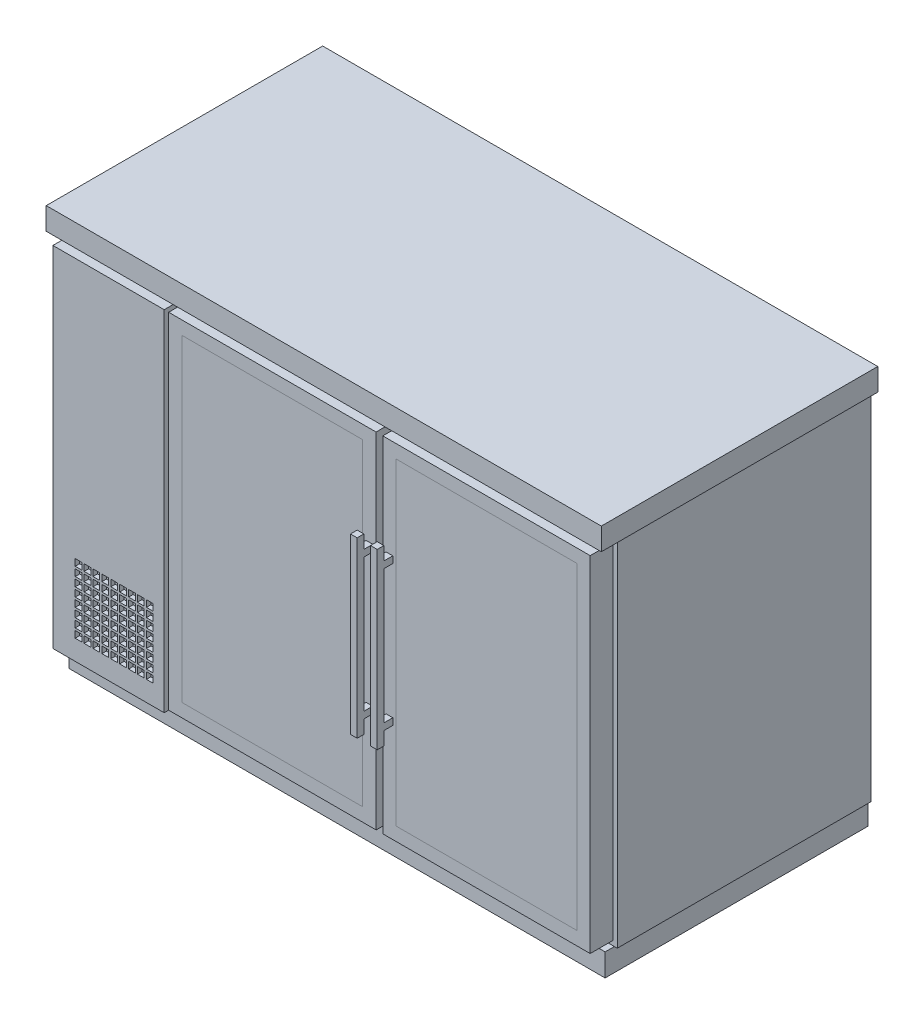
from build123d import *

# Parameters (mm, degrees)
CROQUIS1_W                = 1247
CROQUIS1_H                = 621
SALIENTE_EXTRUIR1_DEPTH   = 50
CROQUIS2_W                = 1217
CROQUIS2_H                = 621
SALIENTE_EXTRUIR2_DEPTH   = 804.2
CROQUIS3_W                = 1204
CROQUIS3_H                = 591
SALIENTE_EXTRUIR3_DEPTH   = 50.8
CROQUIS4_W                = 1217
CROQUIS4_H                = 20
CORTAR_EXTRUIR1_DEPTH     = 50.8
CROQUIS5_W                = 937
CROQUIS5_H                = 754.2
CORTAR_EXTRUIR2_DEPTH     = 570.2
CROQUIS6_W                = 967
CROQUIS6_H                = 784.2
CORTAR_EXTRUIR3_DEPTH     = 50.8
CROQUIS7_W                = 466
CROQUIS7_H                = 774.2
CROQUIS7_W_2              = 406
CROQUIS7_H_2              = 714.2
SALIENTE_EXTRUIR4_DEPTH   = 50.8
SALIENTE_EXTRUIR4_2_DEPTH = 50.8
BARRER1_PROFILE_R         = 6.35
BARRER2_START             = -557.4000001
BARRER2_OUTLINE_R         = 6.35
BARRER2_DEPTH             = 493.8000002
MATRIZL1_COUNT            = 9
MATRIZL1_PITCH            = 51
MATRIZL2_COUNT            = 2
MATRIZL2_PITCH            = 250
CROQUIS35_W               = 15
CROQUIS35_H               = 15
CORTAR_EXTRUIR4_DEPTH     = 10
CROQUIS36_W               = 15
CROQUIS36_H               = 15
SALIENTE_EXTRUIR5_DEPTH   = 35
SALIENTE_EXTRUIR5_2_DEPTH = 35
SALIENTE_EXTRUIR5_3_DEPTH = 35
SALIENTE_EXTRUIR5_4_DEPTH = 35
CROQUIS37_W               = 15
CROQUIS37_H               = 390
SALIENTE_EXTRUIR6_DEPTH   = 15
CROQUIS38_W               = 406
CROQUIS38_H               = 714.2
SALIENTE_EXTRUIR7_DEPTH   = 6
SALIENTE_EXTRUIR7_2_DEPTH = 6


# Read off the part's stored shape, not the designer's step: Barrer2
with BuildPart() as part:
    # Croquis1 → Saliente-Extruir1 (new body)
    with BuildSketch(Plane(origin=(0, 0, 0), x_dir=(1, 0, 0), z_dir=(0, 1, 0))):
        with Locations((623.5, 310.5)):
            Rectangle(CROQUIS1_W, CROQUIS1_H)
    extrude(amount=SALIENTE_EXTRUIR1_DEPTH)


with BuildPart() as body_2:
    # Croquis2 → Saliente-Extruir2 (new body)
    with BuildSketch(Plane.XZ):
        with Locations((623.5, -310.5)):
            Rectangle(CROQUIS2_W, CROQUIS2_H)
    extrude(amount=SALIENTE_EXTRUIR2_DEPTH)

    # Croquis4 → Cortar-Extruir1 (cut)
    with BuildSketch(Plane.XY):
        with Locations((623.5, -10)):
            Rectangle(CROQUIS4_W, CROQUIS4_H)
    extrude(amount=-CORTAR_EXTRUIR1_DEPTH, mode=Mode.SUBTRACT)

    # Croquis5 → Cortar-Extruir2 (cut)
    with BuildSketch(Plane.XY):
        with Locations((733.5, -427.1)):
            Rectangle(CROQUIS5_W, CROQUIS5_H)
    extrude(amount=-CORTAR_EXTRUIR2_DEPTH, mode=Mode.SUBTRACT)

    # Croquis6 → Cortar-Extruir3 (cut)
    with BuildSketch(Plane.XY):
        with Locations((748.5, -412.1)):
            Rectangle(CROQUIS6_W, CROQUIS6_H)
    extrude(amount=-CORTAR_EXTRUIR3_DEPTH, mode=Mode.SUBTRACT)

    # Croquis35 → Cortar-Extruir4 (cut)
    with BuildSketch(Plane.XY):
        with Locations((72.5, -611.7)):
            Rectangle(CROQUIS35_W, CROQUIS35_H)
        with Locations((92.5, -611.7)):
            Rectangle(CROQUIS35_W, CROQUIS35_H)
        with Locations((112.5, -611.7)):
            Rectangle(CROQUIS35_W, CROQUIS35_H)
        with Locations((132.5, -611.7)):
            Rectangle(CROQUIS35_W, CROQUIS35_H)
        with Locations((152.5, -611.7)):
            Rectangle(CROQUIS35_W, CROQUIS35_H)
        with Locations((172.5, -611.7)):
            Rectangle(CROQUIS35_W, CROQUIS35_H)
        with Locations((192.5, -611.7)):
            Rectangle(CROQUIS35_W, CROQUIS35_H)
        with Locations((212.5, -611.7)):
            Rectangle(CROQUIS35_W, CROQUIS35_H)
        with Locations((232.5, -611.7)):
            Rectangle(CROQUIS35_W, CROQUIS35_H)
        with Locations((92.5, -631.7)):
            Rectangle(CROQUIS35_W, CROQUIS35_H)
        with Locations((112.5, -631.7)):
            Rectangle(CROQUIS35_W, CROQUIS35_H)
        with Locations((132.5, -631.7)):
            Rectangle(CROQUIS35_W, CROQUIS35_H)
        with Locations((152.5, -631.7)):
            Rectangle(CROQUIS35_W, CROQUIS35_H)
        with Locations((172.5, -631.7)):
            Rectangle(CROQUIS35_W, CROQUIS35_H)
        with Locations((192.5, -631.7)):
            Rectangle(CROQUIS35_W, CROQUIS35_H)
        with Locations((212.5, -631.7)):
            Rectangle(CROQUIS35_W, CROQUIS35_H)
        with Locations((232.5, -631.7)):
            Rectangle(CROQUIS35_W, CROQUIS35_H)
        with Locations((92.5, -651.7)):
            Rectangle(CROQUIS35_W, CROQUIS35_H)
        with Locations((112.5, -651.7)):
            Rectangle(CROQUIS35_W, CROQUIS35_H)
        with Locations((132.5, -651.7)):
            Rectangle(CROQUIS35_W, CROQUIS35_H)
        with Locations((152.5, -651.7)):
            Rectangle(CROQUIS35_W, CROQUIS35_H)
        with Locations((172.5, -651.7)):
            Rectangle(CROQUIS35_W, CROQUIS35_H)
        with Locations((192.5, -651.7)):
            Rectangle(CROQUIS35_W, CROQUIS35_H)
        with Locations((212.5, -651.7)):
            Rectangle(CROQUIS35_W, CROQUIS35_H)
        with Locations((232.5, -651.7)):
            Rectangle(CROQUIS35_W, CROQUIS35_H)
        with Locations((92.5, -671.7)):
            Rectangle(CROQUIS35_W, CROQUIS35_H)
        with Locations((112.5, -671.7)):
            Rectangle(CROQUIS35_W, CROQUIS35_H)
        with Locations((132.5, -671.7)):
            Rectangle(CROQUIS35_W, CROQUIS35_H)
        with Locations((152.5, -671.7)):
            Rectangle(CROQUIS35_W, CROQUIS35_H)
        with Locations((172.5, -671.7)):
            Rectangle(CROQUIS35_W, CROQUIS35_H)
        with Locations((192.5, -671.7)):
            Rectangle(CROQUIS35_W, CROQUIS35_H)
        with Locations((212.5, -671.7)):
            Rectangle(CROQUIS35_W, CROQUIS35_H)
        with Locations((232.5, -671.7)):
            Rectangle(CROQUIS35_W, CROQUIS35_H)
        with Locations((92.5, -691.7)):
            Rectangle(CROQUIS35_W, CROQUIS35_H)
        with Locations((112.5, -691.7)):
            Rectangle(CROQUIS35_W, CROQUIS35_H)
        with Locations((132.5, -691.7)):
            Rectangle(CROQUIS35_W, CROQUIS35_H)
        with Locations((152.5, -691.7)):
            Rectangle(CROQUIS35_W, CROQUIS35_H)
        with Locations((172.5, -691.7)):
            Rectangle(CROQUIS35_W, CROQUIS35_H)
        with Locations((192.5, -691.7)):
            Rectangle(CROQUIS35_W, CROQUIS35_H)
        with Locations((212.5, -691.7)):
            Rectangle(CROQUIS35_W, CROQUIS35_H)
        with Locations((232.5, -691.7)):
            Rectangle(CROQUIS35_W, CROQUIS35_H)
        with Locations((92.5, -711.7)):
            Rectangle(CROQUIS35_W, CROQUIS35_H)
        with Locations((112.5, -711.7)):
            Rectangle(CROQUIS35_W, CROQUIS35_H)
        with Locations((132.5, -711.7)):
            Rectangle(CROQUIS35_W, CROQUIS35_H)
        with Locations((152.5, -711.7)):
            Rectangle(CROQUIS35_W, CROQUIS35_H)
        with Locations((172.5, -711.7)):
            Rectangle(CROQUIS35_W, CROQUIS35_H)
        with Locations((192.5, -711.7)):
            Rectangle(CROQUIS35_W, CROQUIS35_H)
        with Locations((212.5, -711.7)):
            Rectangle(CROQUIS35_W, CROQUIS35_H)
        with Locations((232.5, -711.7)):
            Rectangle(CROQUIS35_W, CROQUIS35_H)
        with Locations((92.5, -731.7)):
            Rectangle(CROQUIS35_W, CROQUIS35_H)
        with Locations((112.5, -731.7)):
            Rectangle(CROQUIS35_W, CROQUIS35_H)
        with Locations((132.5, -731.7)):
            Rectangle(CROQUIS35_W, CROQUIS35_H)
        with Locations((152.5, -731.7)):
            Rectangle(CROQUIS35_W, CROQUIS35_H)
        with Locations((172.5, -731.7)):
            Rectangle(CROQUIS35_W, CROQUIS35_H)
        with Locations((192.5, -731.7)):
            Rectangle(CROQUIS35_W, CROQUIS35_H)
        with Locations((212.5, -731.7)):
            Rectangle(CROQUIS35_W, CROQUIS35_H)
        with Locations((232.5, -731.7)):
            Rectangle(CROQUIS35_W, CROQUIS35_H)
        with Locations((92.5, -751.7)):
            Rectangle(CROQUIS35_W, CROQUIS35_H)
        with Locations((112.5, -751.7)):
            Rectangle(CROQUIS35_W, CROQUIS35_H)
        with Locations((132.5, -751.7)):
            Rectangle(CROQUIS35_W, CROQUIS35_H)
        with Locations((152.5, -751.7)):
            Rectangle(CROQUIS35_W, CROQUIS35_H)
        with Locations((172.5, -751.7)):
            Rectangle(CROQUIS35_W, CROQUIS35_H)
        with Locations((192.5, -751.7)):
            Rectangle(CROQUIS35_W, CROQUIS35_H)
        with Locations((212.5, -751.7)):
            Rectangle(CROQUIS35_W, CROQUIS35_H)
        with Locations((232.5, -751.7)):
            Rectangle(CROQUIS35_W, CROQUIS35_H)
        with Locations((72.5, -631.7)):
            Rectangle(CROQUIS35_W, CROQUIS35_H)
        with Locations((72.5, -651.7)):
            Rectangle(CROQUIS35_W, CROQUIS35_H)
        with Locations((72.5, -671.7)):
            Rectangle(CROQUIS35_W, CROQUIS35_H)
        with Locations((72.5, -691.7)):
            Rectangle(CROQUIS35_W, CROQUIS35_H)
        with Locations((72.5, -711.7)):
            Rectangle(CROQUIS35_W, CROQUIS35_H)
        with Locations((72.5, -731.7)):
            Rectangle(CROQUIS35_W, CROQUIS35_H)
        with Locations((72.5, -751.7)):
            Rectangle(CROQUIS35_W, CROQUIS35_H)
    extrude(amount=-CORTAR_EXTRUIR4_DEPTH, mode=Mode.SUBTRACT)


with BuildPart() as body_3:
    # Croquis3 → Saliente-Extruir3 (new body)
    with BuildSketch(Plane.XZ.offset(804.2)):
        with Locations((623.5, -325.5)):
            Rectangle(CROQUIS3_W, CROQUIS3_H)
    extrude(amount=SALIENTE_EXTRUIR3_DEPTH)


with BuildPart() as body_4:
    # Croquis7 → Saliente-Extruir4 (new body)
    with BuildSketch(Plane.XY):
        with Locations((508, -407.1)):
            Rectangle(CROQUIS7_W, CROQUIS7_H)
        with Locations((508, -407.1)):
            Rectangle(CROQUIS7_W_2, CROQUIS7_H_2, mode=Mode.SUBTRACT)
    extrude(amount=-SALIENTE_EXTRUIR4_DEPTH)


with BuildPart() as body_5:
    # Croquis7 → Saliente-Extruir4 2 (new body)
    with BuildSketch(Plane.XY):
        with Locations((989, -407.1)):
            Rectangle(CROQUIS7_W, CROQUIS7_H)
        with Locations((989, -407.1)):
            Rectangle(CROQUIS7_W_2, CROQUIS7_H_2, mode=Mode.SUBTRACT)
    extrude(amount=-SALIENTE_EXTRUIR4_2_DEPTH)


with BuildPart() as body_6:
    # Barrer1: sweep along a path in Croquis8
    with BuildLine(Plane(origin=(0, -554.2, 0), x_dir=(1, 0, 0), z_dir=(0, 1, 0))) as barrer1_path:
        Line((277.8, 557.4), (735.5, 557.4))
        Line((735.5, 557.4), (735.5, 63.6))
        Line((735.5, 63.6), (277.8, 63.6))
        Line((277.8, 63.6), (277.8, 557.4))
    # Barrer1 profile (on start of the path) → Barrer1 (sweep)
    with BuildSketch(Plane(origin=(277.8, -554.2, -557.4), x_dir=(0, 0, 1), z_dir=(1, 0, 0))):
        Circle(BARRER1_PROFILE_R)
    sweep(path=barrer1_path.line, transition=Transition.RIGHT)

    # Barrer2 outline → Barrer2 (add)
    with BuildSketch(Plane.XY.offset(BARRER2_START)):
        with Locations((304.15, -554.2)):
            Circle(BARRER2_OUTLINE_R)
    barrer2 = extrude(amount=BARRER2_DEPTH)

    # MatrizL1: Barrer2 ×9
    with Locations(*[(i * MATRIZL1_PITCH, 0, 0) for i in range(1, MATRIZL1_COUNT)]):
        add(barrer2)


with BuildPart() as matrizl2_1:
    # MatrizL2: pattern copy
    add(body_6.part.moved(Location(Vector(0, 1, 0) * (1 * MATRIZL2_PITCH))))


with BuildPart() as body_8:
    # Simetría1: mirrored copy
    add(body_6.part.mirror(Plane(origin=(733.5, 0, 0), x_dir=(0, 0, 1), z_dir=(1, 0, 0))))


with BuildPart() as body_9:
    # Simetr_a1 2: mirrored copy
    add(matrizl2_1.part.mirror(Plane(origin=(733.5, 0, 0), x_dir=(0, 0, 1), z_dir=(1, 0, 0))))


with BuildPart() as body_10:
    # Croquis36 → Saliente-Extruir5 (new body)
    with BuildSketch(Plane.XY):
        with Locations((726, -249.6)):
            Rectangle(CROQUIS36_W, CROQUIS36_H)
    extrude(amount=SALIENTE_EXTRUIR5_DEPTH)



with BuildPart() as body_11:
    # Croquis36 → Saliente-Extruir5 2 (new body)
    with BuildSketch(Plane.XY):
        with Locations((771, -249.6)):
            Rectangle(CROQUIS36_W, CROQUIS36_H)
    extrude(amount=SALIENTE_EXTRUIR5_2_DEPTH)


with BuildPart() as body_12:
    # Croquis36 → Saliente-Extruir5 3 (new body)
    with BuildSketch(Plane.XY):
        with Locations((726, -564.6)):
            Rectangle(CROQUIS36_W, CROQUIS36_H)
    extrude(amount=SALIENTE_EXTRUIR5_3_DEPTH)


with BuildPart() as body_13:
    # Croquis36 → Saliente-Extruir5 4 (new body)
    with BuildSketch(Plane.XY):
        with Locations((771, -564.6)):
            Rectangle(CROQUIS36_W, CROQUIS36_H)
    extrude(amount=SALIENTE_EXTRUIR5_4_DEPTH)


with BuildPart() as body_10_1:
    add(body_10.part)

    add(body_11.part)  # Saliente-Extruir6 merges body 11

    add(body_12.part)  # Saliente-Extruir6 merges body 12

    add(body_13.part)  # Saliente-Extruir6 merges body 13
    # Croquis37 → Saliente-Extruir6 (add)
    with BuildSketch(Plane.XY.offset(35)):
        with Locations((726, -407.1)):
            Rectangle(CROQUIS37_W, CROQUIS37_H)
        with Locations((771, -407.1)):
            Rectangle(CROQUIS37_W, CROQUIS37_H)
    extrude(amount=-SALIENTE_EXTRUIR6_DEPTH)


with BuildPart() as body_11_2:
    # Croquis38 → Saliente-Extruir7 (new body)
    with BuildSketch(Plane.XY):
        with Locations((508, -407.1)):
            Rectangle(CROQUIS38_W, CROQUIS38_H)
    extrude(amount=-SALIENTE_EXTRUIR7_DEPTH)


with BuildPart() as body_12_2:
    # Croquis38 → Saliente-Extruir7 2 (new body)
    with BuildSketch(Plane.XY):
        with Locations((989, -407.1)):
            Rectangle(CROQUIS38_W, CROQUIS38_H)
    extrude(amount=-SALIENTE_EXTRUIR7_2_DEPTH)


solid = Compound([part.part, body_2.part, body_3.part, body_4.part, body_5.part, body_6.part, matrizl2_1.part, body_8.part, body_9.part, body_10_1.part, body_11_2.part, body_12_2.part])
